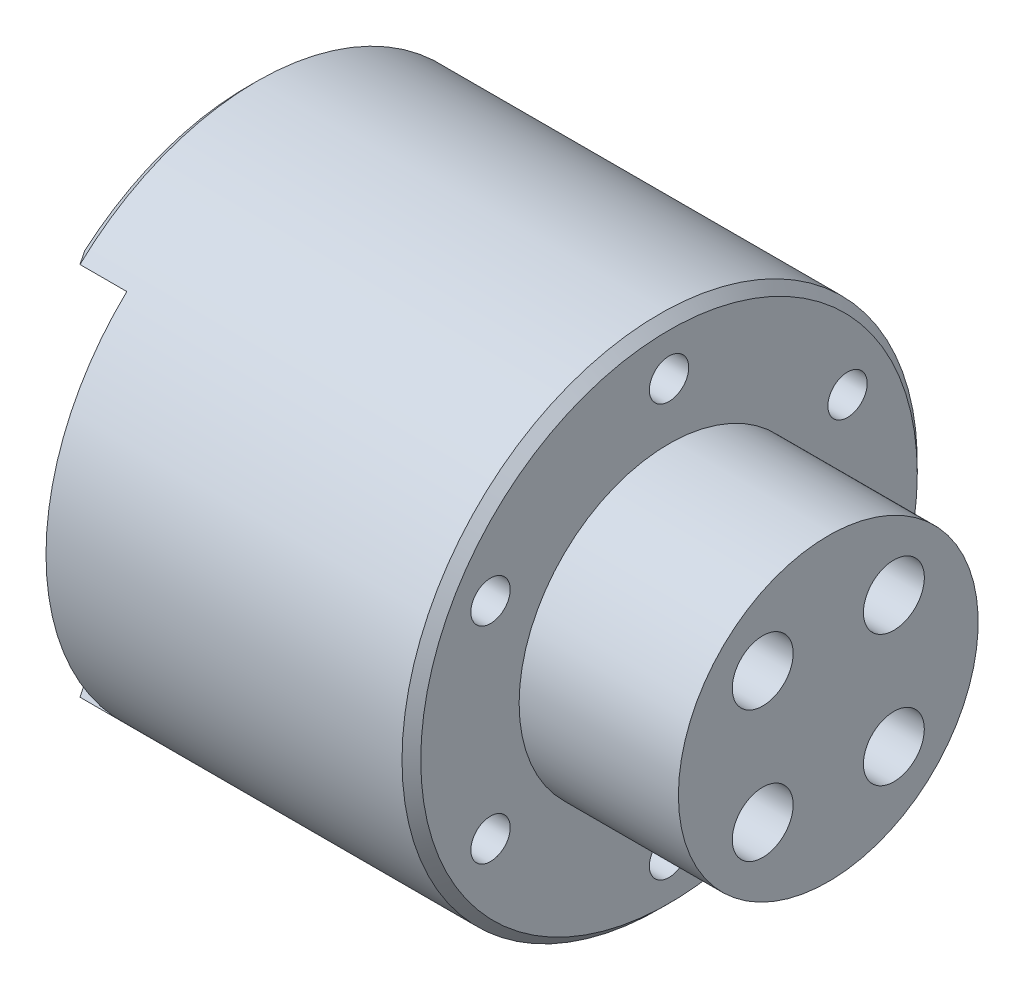
from build123d import *

# Parameters (mm, degrees)
SKETCH2_R          = 3.25
CUT_EXTRUDE1_DEPTH = 74.188113789
SKETCH3_R          = 2.1
CUT_EXTRUDE2_DEPTH = 20
CHAMFER1_SIZE      = 1
CUT_EXTRUDE3_START = -6
CUT_EXTRUDE3_DEPTH = 6
CIRPATTERN1_COUNT  = 6


with BuildPart() as part:
    # Sketch1 → Revolve1 (revolve)
    with BuildSketch(Plane.XY):
        Polygon((0, 0), (0, 27.5), (45, 27.5), (45, 16), (62, 16), (62, 0), align=None)
    revolve(axis=Axis((0, 0, 0), (1, 0, 0)))

    # Sketch2 → Cut-Extrude1 (cut, through all)
    with BuildSketch(Plane.ZY):
        with Locations((-7, 7)):
            Circle(SKETCH2_R)
        with Locations((7, 7)):
            Circle(SKETCH2_R)
        with Locations((7, -7)):
            Circle(SKETCH2_R)
        with Locations((-7, -7)):
            Circle(SKETCH2_R)
    extrude(amount=-CUT_EXTRUDE1_DEPTH, mode=Mode.SUBTRACT)

    # Sketch3 → Cut-Extrude2 (cut)
    with BuildSketch(Plane(origin=(45, 0, 0), x_dir=(0, 0, -1), z_dir=(1, 0, 0))):
        with Locations((0, 22)):
            Circle(SKETCH3_R)
    cut_extrude2 = extrude(amount=-CUT_EXTRUDE2_DEPTH, mode=Mode.SUBTRACT)

    # Chamfer1
    chamfer1_edges = [part.edges().sort_by_distance(p)[0] for p in [
        (0, -27.5, 0),
        (45, -27.5, 0),
        (0, 7, -10.25),
        (0, 7, 3.75),
        (0, -7, 3.75),
        (0, -7, -10.25),
    ]]
    chamfer(chamfer1_edges, length=CHAMFER1_SIZE)

    # Sketch4 → Cut-Extrude3 (cut)
    with BuildSketch(Plane.ZY.offset(CUT_EXTRUDE3_START)):
        with BuildLine():
            Line((-18.874586088, 20), (18.874586088, 20))
            ThreePointArc((18.874586088, 20), (27.5, 0), (18.874586088, -20))
            Line((18.874586088, -20), (-18.874586088, -20))
            ThreePointArc((-18.874586088, -20), (-27.5, 0), (-18.874586088, 20))
        make_face()
    extrude(amount=CUT_EXTRUDE3_DEPTH, mode=Mode.SUBTRACT)

    # CirPattern1: Cut-Extrude2 ×6 about axis
    cirpattern1_axis = Axis((62, 0, 0), (-1, 0, 0))
    for i in range(1, CIRPATTERN1_COUNT):
        add(cut_extrude2.rotate(cirpattern1_axis, i * 360 / CIRPATTERN1_COUNT), mode=Mode.SUBTRACT)


solid = part.part
